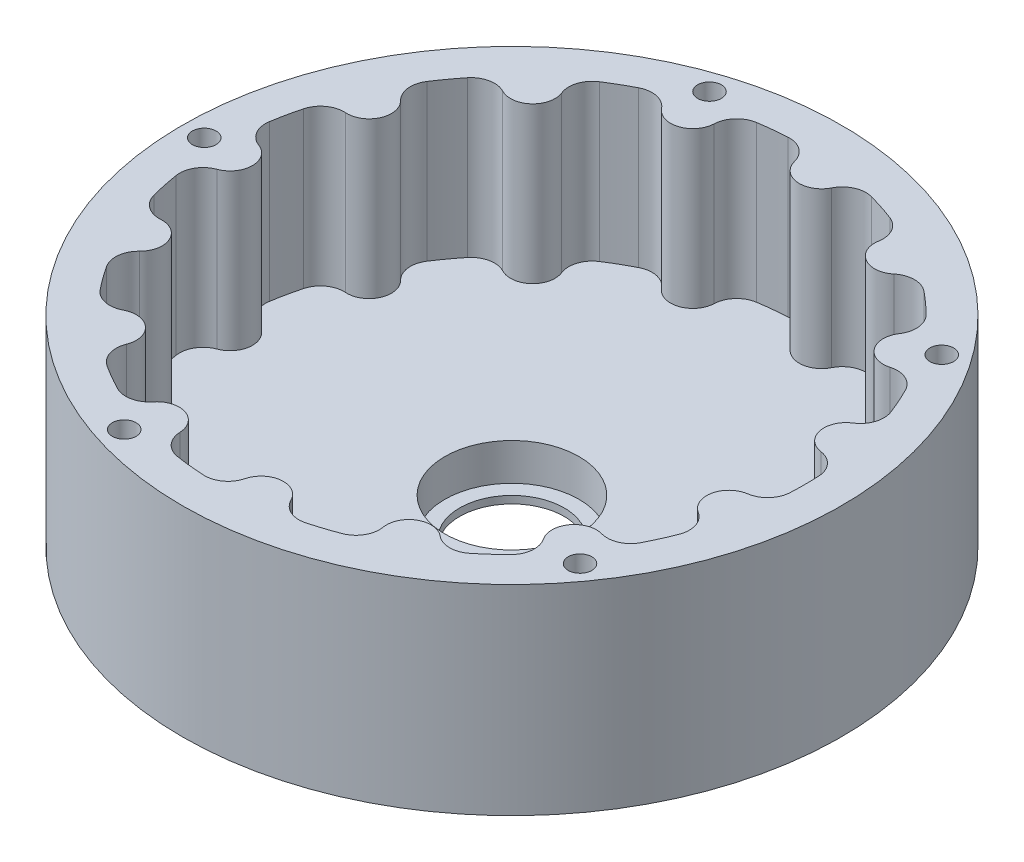
from build123d import *

# Parameters (mm, degrees)
SKETCH1_R            = 44.45
BOSS_EXTRUDE1_DEPTH  = 27
SKETCH1_3_R          = 44.45
BOSS_EXTRUDE2_DEPTH  = 6
SKETCH2_R            = 7.05
CUT_EXTRUDE1_DEPTH   = 69.414947197
CUT_EXTRUDE2_START   = 1
SKETCH2_3_R          = 9.05
SKETCH2_3_R_2        = 7.05
CUT_EXTRUDE2_DEPTH   = 68.414947197
M3_CLEARANCE_HOLE1_D = 3.2
CIRPATTERN1_COUNT    = 5


with BuildPart() as part:
    # Sketch1 → Boss-Extrude1 (new body)
    with BuildSketch(Plane(origin=(0, 0, 0), x_dir=(1, 0, 0), z_dir=(0, 1, 0))):
        Circle(SKETCH1_R)
        with BuildLine():
            ThreePointArc((-38.994571123, -6.298684221), (-38.602185265, -4.191732911), (-36.960419774, -2.814120281))
            ThreePointArc((-36.960419774, -2.814120281), (-35, 0), (-36.960419774, 2.814120281))
            ThreePointArc((-36.960419774, 2.814120281), (-38.602185265, 4.191732911), (-38.994571123, 6.298684221))
            ThreePointArc((-38.994571123, 6.298684221), (-38.827494163, 7.257802493), (-38.636830229, 8.212511787))
            ThreePointArc((-38.636830229, 8.212511787), (-38.422695146, 9.162232135), (-38.185218998, 10.106386598))
            ThreePointArc((-38.185218998, 10.106386598), (-36.969782377, 11.87158469), (-34.909629433, 12.462330266))
            ThreePointArc((-34.909629433, 12.462330266), (-31.974091017, 14.235782508), (-32.620417761, 17.603983865))
            ThreePointArc((-32.620417761, 17.603983865), (-33.559919631, 19.53026181), (-33.061407647, 21.614655316))
            ThreePointArc((-33.061407647, 21.614655316), (-32.518666702, 22.422897135), (-31.956171278, 23.217517466))
            ThreePointArc((-31.956171278, 23.217517466), (-31.37426308, 23.99803359), (-30.773295606, 24.76397136))
            ThreePointArc((-30.773295606, 24.76397136), (-28.944968255, 25.882197447), (-26.82264702, 25.583930693))
            ThreePointArc((-26.82264702, 25.583930693), (-23.419571223, 26.010068892), (-22.64004917, 29.349958712))
            ThreePointArc((-22.64004917, 29.349958712), (-22.714839011, 31.491831016), (-21.411626434, 33.193256144))
            ThreePointArc((-21.411626434, 33.193256144), (-20.587066345, 33.710869157), (-19.75, 34.208003449))
            ThreePointArc((-19.75, 34.208003449), (-18.900935901, 34.684357023), (-18.040389838, 35.139640501))
            ThreePointArc((-18.040389838, 35.139640501), (-15.915306166, 35.417543134), (-14.09778526, 34.28183708))
            ThreePointArc((-14.09778526, 34.28183708), (-10.815594803, 33.28697807), (-8.745010399, 36.021059062))
            ThreePointArc((-8.745010399, 36.021059062), (-7.942156368, 38.008176545), (-6.059580493, 39.032441433))
            ThreePointArc((-6.059580493, 39.032441433), (-5.09577519, 39.169925647), (-4.128874299, 39.283614867))
            ThreePointArc((-4.128874299, 39.283614867), (-3.159465195, 39.373440029), (-2.188136774, 39.439346565))
            ThreePointArc((-2.188136774, 39.439346565), (-0.133743055, 38.828873854), (1.064711645, 37.052102396))
            ThreePointArc((1.064711645, 37.052102396), (3.658496214, 34.808266338), (6.662120116, 36.463791059))
            ThreePointArc((6.662120116, 36.463791059), (8.203797264, 37.952563055), (10.340221965, 38.122563))
            ThreePointArc((10.340221965, 38.122563), (11.276621789, 37.856146146), (12.206171278, 37.566732394))
            ThreePointArc((12.206171278, 37.566732394), (13.128305747, 37.254497557), (14.042465016, 36.919631313))
            ThreePointArc((14.042465016, 36.919631313), (15.670945446, 35.526339536), (16.043110235, 33.415722599))
            ThreePointArc((16.043110235, 33.415722599), (17.5, 30.310889132), (20.917309539, 30.601602319))
            ThreePointArc((20.917309539, 30.601602319), (22.931239819, 31.334606626), (24.952106107, 30.620947092))
            ThreePointArc((24.952106107, 30.620947092), (25.699188416, 29.996695064), (26.430658951, 29.354220606))
            ThreePointArc((26.430658951, 29.354220606), (27.146073357, 28.693914011), (27.844997033, 28.016176403))
            ThreePointArc((27.844997033, 28.016176403), (28.765985113, 26.080978366), (28.247509317, 24.001460793))
            ThreePointArc((28.247509317, 24.001460793), (28.315594803, 20.57248383), (31.555706116, 19.448118531))
            ThreePointArc((31.555706116, 19.448118531), (33.693662686, 19.298612044), (35.249544421, 17.824691249))
            ThreePointArc((35.249544421, 17.824691249), (35.678131896, 16.950542893), (36.085045577, 16.066097401))
            ThreePointArc((36.085045577, 16.066097401), (36.47003827, 15.171892057), (36.8328761, 14.268470073))
            ThreePointArc((36.8328761, 14.268470073), (36.887124623, 12.125979097), (35.567657418, 10.437128369))
            ThreePointArc((35.567657418, 10.437128369), (34.235166026, 7.276909179), (36.73783443, 4.931878368))
            ThreePointArc((36.73783443, 4.931878368), (38.630145177, 3.925712118), (39.452016272, 1.946384357))
            ThreePointArc((39.452016272, 1.946384357), (39.488002246, 0.973487866), (39.5, 0))
            ThreePointArc((39.5, 0), (39.488002246, -0.973487866), (39.452016272, -1.946384357))
            ThreePointArc((39.452016272, -1.946384357), (38.630145177, -3.925712118), (36.73783443, -4.931878368))
            ThreePointArc((36.73783443, -4.931878368), (34.235166026, -7.276909179), (35.567657418, -10.437128369))
            ThreePointArc((35.567657418, -10.437128369), (36.887124623, -12.125979097), (36.8328761, -14.268470073))
            ThreePointArc((36.8328761, -14.268470073), (36.47003827, -15.171892057), (36.085045577, -16.066097401))
            ThreePointArc((36.085045577, -16.066097401), (35.678131896, -16.950542893), (35.249544421, -17.824691249))
            ThreePointArc((35.249544421, -17.824691249), (33.693662686, -19.298612044), (31.555706116, -19.448118531))
            ThreePointArc((31.555706116, -19.448118531), (28.315594803, -20.57248383), (28.247509317, -24.001460793))
            ThreePointArc((28.247509317, -24.001460793), (28.765985113, -26.080978366), (27.844997033, -28.016176403))
            ThreePointArc((27.844997033, -28.016176403), (27.146073357, -28.693914011), (26.430658951, -29.354220606))
            ThreePointArc((26.430658951, -29.354220606), (25.699188416, -29.996695064), (24.952106107, -30.620947092))
            ThreePointArc((24.952106107, -30.620947092), (22.931239819, -31.334606626), (20.917309539, -30.601602319))
            ThreePointArc((20.917309539, -30.601602319), (17.5, -30.310889132), (16.043110235, -33.415722599))
            ThreePointArc((16.043110235, -33.415722599), (15.670945446, -35.526339536), (14.042465016, -36.919631313))
            ThreePointArc((14.042465016, -36.919631313), (13.128305747, -37.254497557), (12.206171278, -37.566732394))
            ThreePointArc((12.206171278, -37.566732394), (11.276621789, -37.856146146), (10.340221965, -38.122563))
            ThreePointArc((10.340221965, -38.122563), (8.203797264, -37.952563055), (6.662120116, -36.463791059))
            ThreePointArc((6.662120116, -36.463791059), (3.658496214, -34.808266338), (1.064711645, -37.052102396))
            ThreePointArc((1.064711645, -37.052102396), (-0.133743055, -38.828873854), (-2.188136774, -39.439346565))
            ThreePointArc((-2.188136774, -39.439346565), (-3.159465195, -39.373440029), (-4.128874299, -39.283614867))
            ThreePointArc((-4.128874299, -39.283614867), (-5.09577519, -39.169925647), (-6.059580493, -39.032441433))
            ThreePointArc((-6.059580493, -39.032441433), (-7.942156368, -38.008176545), (-8.745010399, -36.021059062))
            ThreePointArc((-8.745010399, -36.021059062), (-10.815594803, -33.28697807), (-14.09778526, -34.28183708))
            ThreePointArc((-14.09778526, -34.28183708), (-15.915306166, -35.417543134), (-18.040389838, -35.139640501))
            ThreePointArc((-18.040389838, -35.139640501), (-18.900935901, -34.684357023), (-19.75, -34.208003449))
            ThreePointArc((-19.75, -34.208003449), (-20.587066345, -33.710869157), (-21.411626434, -33.193256144))
            ThreePointArc((-21.411626434, -33.193256144), (-22.714839011, -31.491831016), (-22.64004917, -29.349958712))
            ThreePointArc((-22.64004917, -29.349958712), (-23.419571223, -26.010068892), (-26.82264702, -25.583930693))
            ThreePointArc((-26.82264702, -25.583930693), (-28.944968255, -25.882197447), (-30.773295606, -24.76397136))
            ThreePointArc((-30.773295606, -24.76397136), (-31.37426308, -23.99803359), (-31.956171278, -23.217517466))
            ThreePointArc((-31.956171278, -23.217517466), (-32.518666702, -22.422897135), (-33.061407647, -21.614655316))
            ThreePointArc((-33.061407647, -21.614655316), (-33.559919631, -19.53026181), (-32.620417761, -17.603983865))
            ThreePointArc((-32.620417761, -17.603983865), (-31.974091017, -14.235782508), (-34.909629433, -12.462330266))
            ThreePointArc((-34.909629433, -12.462330266), (-36.969782377, -11.87158469), (-38.185218998, -10.106386598))
            ThreePointArc((-38.185218998, -10.106386598), (-38.422695146, -9.162232135), (-38.636830229, -8.212511787))
            ThreePointArc((-38.636830229, -8.212511787), (-38.827494163, -7.257802493), (-38.994571123, -6.298684221))
        make_face(mode=Mode.SUBTRACT)
    extrude(amount=BOSS_EXTRUDE1_DEPTH)

    # Sketch1<3> → Boss-Extrude2 (add)
    with BuildSketch(Plane(origin=(0, 0, 0), x_dir=(1, 0, 0), z_dir=(0, 1, 0))):
        Circle(SKETCH1_3_R)
    extrude(amount=BOSS_EXTRUDE2_DEPTH)

    # Sketch2 → Cut-Extrude1 (cut, through all)
    with BuildSketch(Plane(origin=(0, 0, 0), x_dir=(1, 0, 0), z_dir=(0, 1, 0))):
        Circle(SKETCH2_R)
    extrude(amount=CUT_EXTRUDE1_DEPTH, mode=Mode.SUBTRACT)

    # Sketch2<3> → Cut-Extrude2 (cut, through all)
    with BuildSketch(Plane(origin=(0, 0, 0), x_dir=(1, 0, 0), z_dir=(0, 1, 0)).offset(CUT_EXTRUDE2_START)):
        Circle(SKETCH2_3_R)
        Circle(SKETCH2_3_R_2, mode=Mode.SUBTRACT)
    extrude(amount=CUT_EXTRUDE2_DEPTH, mode=Mode.SUBTRACT)

    # M3 Clearance Hole1 (through all)
    with Locations(Plane(origin=(0, 27, 0), x_dir=(1, 0, 0), z_dir=(0, 1, 0))):
        with Locations((-41.5, 0)):
            m3_clearance_hole1 = Hole(M3_CLEARANCE_HOLE1_D / 2)

    # CirPattern1: M3 Clearance Hole1 ×5 about axis
    cirpattern1_axis = Axis((0, 27, 0), (0, -1, 0))
    for i in range(1, CIRPATTERN1_COUNT):
        add(m3_clearance_hole1.rotate(cirpattern1_axis, i * 360 / CIRPATTERN1_COUNT), mode=Mode.SUBTRACT)


solid = part.part
